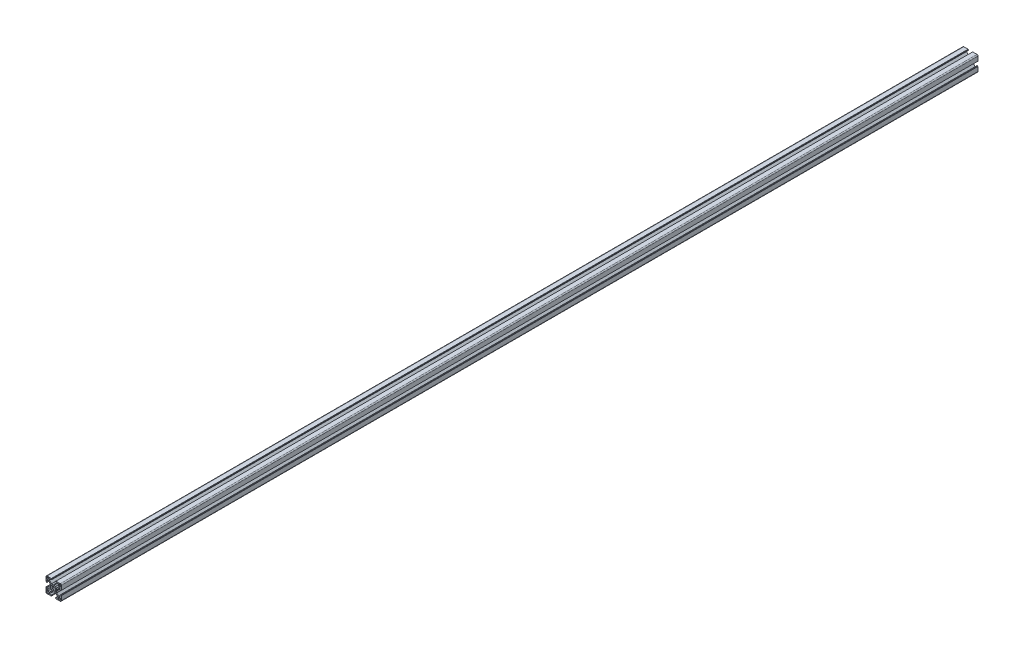
from build123d import *

# Parameters (mm, degrees)
BOSS_EXTRUDE1_DEPTH = 900
CIRPATTERN1_COUNT   = 4


with BuildPart() as part:
    # Sketch3 → Boss-Extrude1 (new, symmetric)
    with BuildSketch(Plane.XY):
        with BuildLine():
            Line((-4.503841895, 3.156803476), (-3.14772708, 1.530298739))
            ThreePointArc((-3.14772708, 1.530298739), (-3.410794979, 0.785160882), (-3.5, 0))
            Line((-3.5, 0), (-5.5, 0))
            Line((-5.5, 0), (-6, 0.866025404))
            Line((-6, 0.866025404), (-6, 3.996841995))
            ThreePointArc((-6, 3.996841995), (-6.038060234, 4.188183711), (-6.146446609, 4.350395385))
            Line((-6.146446609, 4.350395385), (-9.917104615, 8.121053391))
            ThreePointArc((-9.917104615, 8.121053391), (-10.079316289, 8.229439766), (-10.270658005, 8.2675))
            Line((-10.270658005, 8.2675), (-12.29, 8.2675))
            ThreePointArc((-12.29, 8.2675), (-12.643553391, 8.121053391), (-12.79, 7.7675))
            Line((-12.79, 7.7675), (-12.79, 4.5))
            ThreePointArc((-12.79, 4.5), (-12.936446609, 4.146446609), (-13.29, 4))
            Line((-13.29, 4), (-14.5, 4))
            Line((-14.5, 4), (-14.5, 4.5))
            Line((-14.5, 4.5), (-15, 4.5))
            Line((-15, 4.5), (-15, 12.968))
            ThreePointArc((-15, 12.968), (-14.404840979, 14.404840979), (-12.968, 15))
            Line((-12.968, 15), (-4.5, 15))
            Line((-4.5, 15), (-4.5, 14.5))
            Line((-4.5, 14.5), (-4, 14.5))
            Line((-4, 14.5), (-4, 13.29))
            ThreePointArc((-4, 13.29), (-4.146446609, 12.936446609), (-4.5, 12.79))
            Line((-4.5, 12.79), (-7.7675, 12.79))
            ThreePointArc((-7.7675, 12.79), (-8.121053391, 12.643553391), (-8.2675, 12.29))
            Line((-8.2675, 12.29), (-8.2675, 10.270658005))
            ThreePointArc((-8.2675, 10.270658005), (-8.229439766, 10.079316289), (-8.121053391, 9.917104615))
            Line((-8.121053391, 9.917104615), (-4.350395385, 6.146446609))
            ThreePointArc((-4.350395385, 6.146446609), (-4.188183711, 6.038060234), (-3.996841995, 6))
            Line((-3.996841995, 6), (-0.866025404, 6))
            Line((-0.866025404, 6), (0, 5.5))
            Line((0, 5.5), (0, 3.5))
            ThreePointArc((0, 3.5), (-0.785160882, 3.410794979), (-1.530298739, 3.14772708))
            Line((-1.530298739, 3.14772708), (-3.156803476, 4.503841895))
            ThreePointArc((-3.156803476, 4.503841895), (-3.889087297, 3.889087297), (-4.503841895, 3.156803476))
        make_face()
        with BuildLine():
            Line((-12.705, 9.5135), (-10.5135, 9.5135))
            ThreePointArc((-10.5135, 9.5135), (-9.806393219, 9.806393219), (-9.5135, 10.5135))
            Line((-9.5135, 10.5135), (-9.5135, 12.705))
            ThreePointArc((-9.5135, 12.705), (-9.806393219, 13.412106781), (-10.5135, 13.705))
            Line((-10.5135, 13.705), (-12.705, 13.705))
            ThreePointArc((-12.705, 13.705), (-13.412106781, 13.412106781), (-13.705, 12.705))
            Line((-13.705, 12.705), (-13.705, 10.5135))
            ThreePointArc((-13.705, 10.5135), (-13.412106781, 9.806393219), (-12.705, 9.5135))
        make_face(mode=Mode.SUBTRACT)
    boss_extrude1 = extrude(amount=BOSS_EXTRUDE1_DEPTH, both=True)

    # CirPattern1: Boss-Extrude1 ×4 about axis
    cirpattern1_axis = Axis((0, 0, 76.2), (0, 0, -1))
    for i in range(1, CIRPATTERN1_COUNT):
        add(boss_extrude1.rotate(cirpattern1_axis, i * 360 / CIRPATTERN1_COUNT))


solid = part.part
